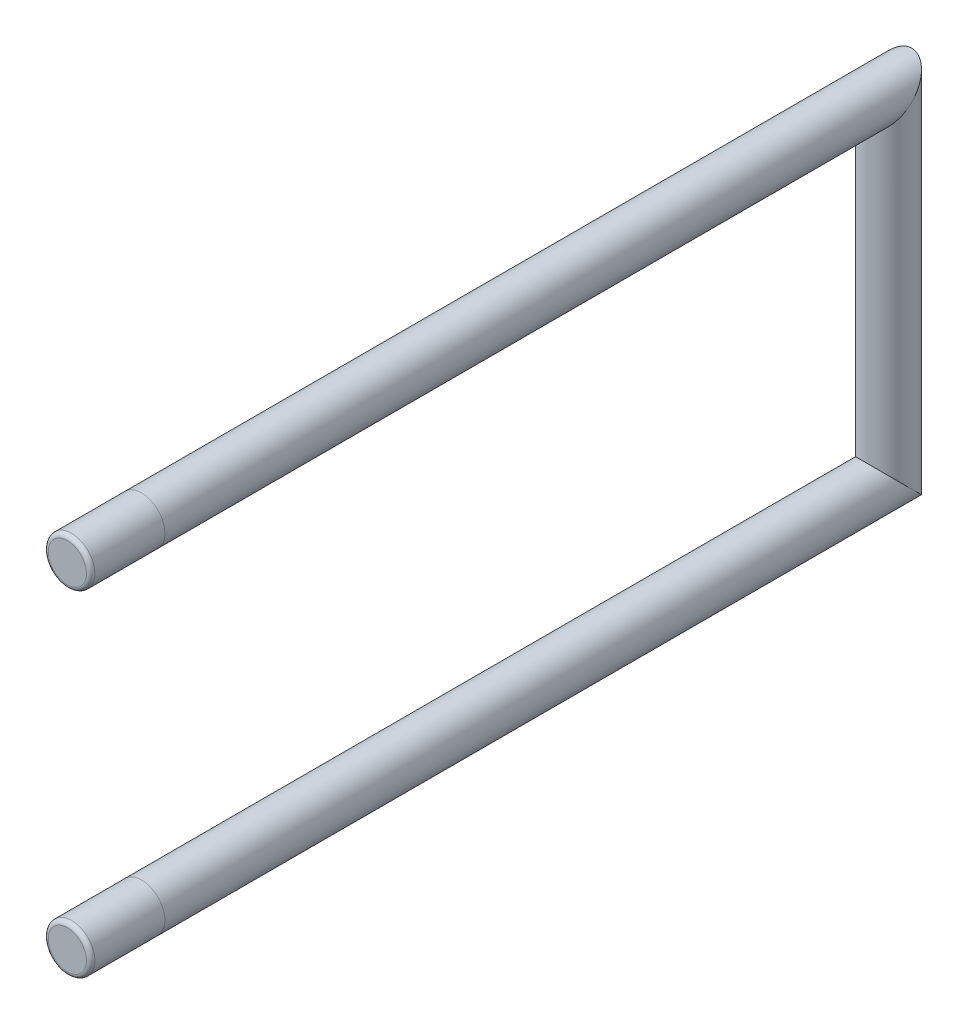
from build123d import *

# Parameters (mm, degrees)
SKETCH_1_R                 = 11
EXTRUDE_1_DEPTH            = 352
SKETCH_2_R                 = 11
EXTRUDE_2_DEPTH            = 158
PATTERN_LINEAR_1_OUTLINE_R = 11
PATTERN_LINEAR_1_DEPTH     = 352
SKETCH_3_R                 = 10.9995
EXTRUDE_3_DEPTH            = 35
CHAMFER_1_SIZE             = 21.999
FILLET_1_R                 = 2


with BuildPart() as part:
    # 草图1 → 拉伸1 (new body)
    with BuildSketch(Plane.XY):
        Circle(SKETCH_1_R)
    extrude(amount=EXTRUDE_1_DEPTH)

    # 草图2 → 拉伸2 (add)
    with BuildSketch(Plane(origin=(0, 0, 0), x_dir=(1, 0, 0), z_dir=(0, 1, 0))):
        with Locations(Location((0, 0, 0), (0, 0, 180))):
            Circle(SKETCH_2_R)
    extrude(amount=EXTRUDE_2_DEPTH)


with BuildPart() as pattern_linear_1_tool:
    # 阵列(线性)1: read off the stored shape, not the designer's step
    # 阵列(线性)1 outline → 阵列(线性)1 (new body)
    with BuildSketch(Plane.XY):
        with Locations((0, 158)):
            Circle(PATTERN_LINEAR_1_OUTLINE_R)
    extrude(amount=PATTERN_LINEAR_1_DEPTH)


with BuildPart() as part_1:
    add(part.part)


with BuildPart() as part_2:
    # 阵列(线性)1: joined with pattern_linear_1_tool
    add(part_1.part.fuse(pattern_linear_1_tool.part, tol=0.00001))

    # 草图3 → 拉伸3 (add)
    with BuildSketch(Plane.XY.offset(352)):
        with Locations((0, 158)):
            Circle(SKETCH_3_R)
        Circle(SKETCH_3_R)
    extrude(amount=EXTRUDE_3_DEPTH)

    # 倒角1
    # the kernel refuses this chamfer: 21.999 mm, written as the material it adds along each edge
    with BuildSketch(Plane(origin=(67.574454052, 0, 0), x_dir=(0, -1, 0), z_dir=(-1, 0, 0))) as chamfer_1_piece_1_section:
        Polygon((CHAMFER_1_SIZE, 0), (0, -CHAMFER_1_SIZE), (0, 0), align=None)
    chamfer_1_piece_1 = extrude(amount=135.148908105, mode=Mode.PRIVATE)
    chamfer_1_piece_1 = chamfer_1_piece_1 & Plane(origin=(0, 0, 0), x_dir=(1, 0, 0), z_dir=(0, 0, -1)) * Cylinder(11, 359, mode=Mode.PRIVATE)
    chamfer_1_piece_1 = chamfer_1_piece_1 & Plane(origin=(0, 0, 0), x_dir=(-1, 0, 0), z_dir=(0, -1, 0)) * Cylinder(11, 359, mode=Mode.PRIVATE)
    add(chamfer_1_piece_1)
    with BuildSketch(Plane(origin=(-67.574454052, 158, 0), x_dir=(0, 0, -1), z_dir=(1, 0, 0))) as chamfer_1_piece_2_section:
        Polygon((CHAMFER_1_SIZE, 0), (0, CHAMFER_1_SIZE), (0, 0), align=None)
    chamfer_1_piece_2 = extrude(amount=135.148908105, mode=Mode.PRIVATE)
    chamfer_1_piece_2 = chamfer_1_piece_2 & Plane(origin=(0, 158, 0), x_dir=(-1, 0, 0), z_dir=(0, -1, 0)) * Cylinder(11, 359, mode=Mode.PRIVATE)
    chamfer_1_piece_2 = chamfer_1_piece_2 & Plane(origin=(0, 158, 0), x_dir=(1, 0, 0), z_dir=(0, 0, -1)) * Cylinder(11, 359, mode=Mode.PRIVATE)
    add(chamfer_1_piece_2)

    # 圆角1
    fillet_1_edges = [part_2.edges().sort_by_distance(p)[0] for p in [
        (-10.9995, 158, 387),
        (-10.9995, 0, 387),
    ]]
    fillet(fillet_1_edges, radius=FILLET_1_R)


solid = part_2.part
